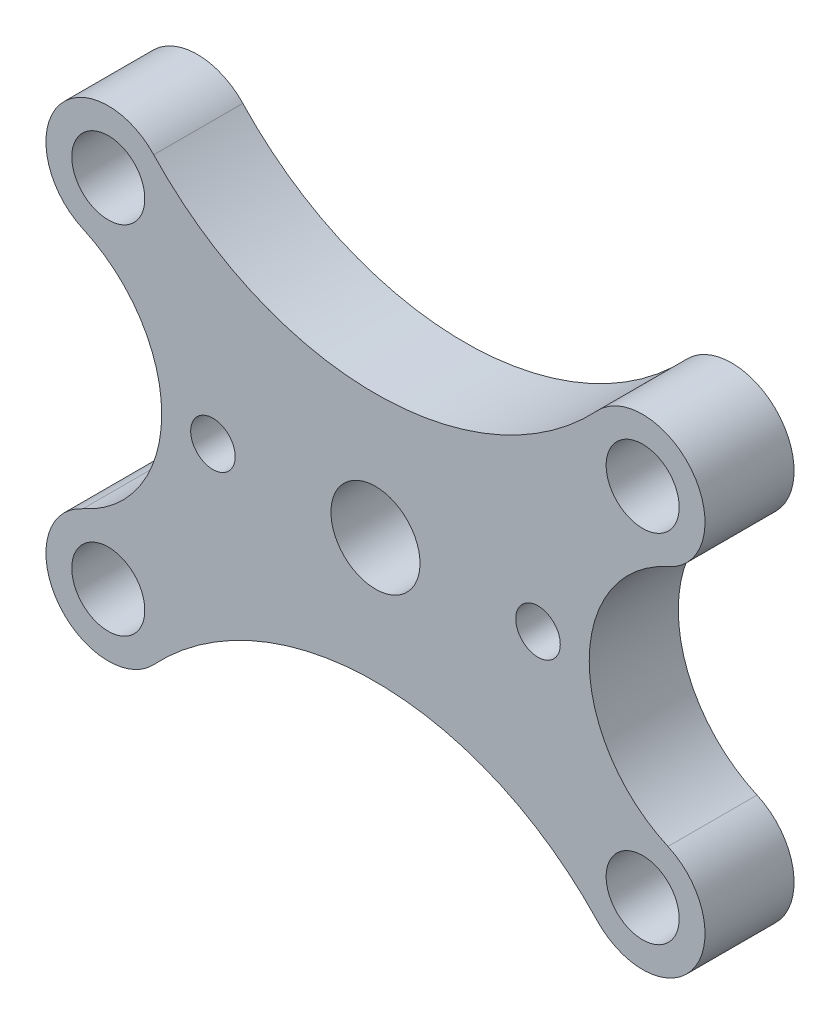
from build123d import *

# Parameters (mm, degrees)
SALIENTE_EXTRUIR1_DEPTH = 10
CROQUIS3_R              = 4.1
CORTAR_EXTRUIR1_DEPTH   = 47.882832679
CROQUIS9_R              = 2.5
CORTAR_EXTRUIR6_DEPTH   = 47.882832679
SIMETR_A2_OUTLINE_R     = 4.1
SIMETR_A2_OUTLINE_R_2   = 2.5
SIMETR_A2_DEPTH         = 10
CROQUIS8_R              = 5
CORTAR_EXTRUIR2_DEPTH   = 10


# Read off the part's stored shape, not the designer's step: Simetría2
with BuildPart() as part:
    # Croquis2 → Saliente-Extruir1 (new body)
    with BuildSketch(Plane.XY):
        with BuildLine():
            Line((24, 0), (0, 0))
            Line((0, 0), (0, 14))
            ThreePointArc((0, 14), (13.564530661, 16.812621552), (24.892422825, 24.786716558))
            ThreePointArc((24.892422825, 24.786716558), (35.705553054, 24.055448723), (32.841827768, 13.602811951))
            ThreePointArc((32.841827768, 13.602811951), (26.404704634, 8.111941988), (24, 0))
        make_face()
    saliente_extruir1 = extrude(amount=SALIENTE_EXTRUIR1_DEPTH)

    # Croquis3 → Cortar-Extruir1 (cut, through all)
    with BuildSketch(Plane.XY):
        with Locations((30, 20)):
            Circle(CROQUIS3_R)
    cortar_extruir1 = extrude(amount=CORTAR_EXTRUIR1_DEPTH, mode=Mode.SUBTRACT)

    # Simetría1: Saliente-Extruir1, Cortar-Extruir1 across plane
    add(saliente_extruir1.mirror(Plane.ZX))
    add(cortar_extruir1.mirror(Plane.ZX), mode=Mode.SUBTRACT)

    # Croquis9 → Cortar-Extruir6 (cut, through all)
    with BuildSketch(Plane.XY):
        with Locations((18.25, 0)):
            Circle(CROQUIS9_R)
    extrude(amount=CORTAR_EXTRUIR6_DEPTH, mode=Mode.SUBTRACT)

    # Simetría2 outline → Simetría2 (add)
    with BuildSketch(Plane.XY):
        with BuildLine():
            Line((0, -14), (0, 14))
            ThreePointArc((0, 14), (-13.564530661, 16.812621552), (-24.892422825, 24.786716558))
            ThreePointArc((-24.892422825, 24.786716558), (-35.705553054, 24.055448723), (-32.841827768, 13.602811951))
            ThreePointArc((-32.841827768, 13.602811951), (-24, 0), (-32.841827768, -13.602811951))
            ThreePointArc((-32.841827768, -13.602811951), (-35.705553054, -24.055448723), (-24.892422825, -24.786716558))
            ThreePointArc((-24.892422825, -24.786716558), (-13.564530661, -16.812621552), (0, -14))
        make_face()
        with Locations((-30, -20)):
            Circle(SIMETR_A2_OUTLINE_R, mode=Mode.SUBTRACT)
        with Locations((-30, 20)):
            Circle(SIMETR_A2_OUTLINE_R, mode=Mode.SUBTRACT)
        with Locations((-18.25, 0)):
            Circle(SIMETR_A2_OUTLINE_R_2, mode=Mode.SUBTRACT)
    extrude(amount=SIMETR_A2_DEPTH)

    # Croquis8 → Cortar-Extruir2 (cut)
    with BuildSketch(Plane.XY):
        Circle(CROQUIS8_R)
    extrude(amount=CORTAR_EXTRUIR2_DEPTH, mode=Mode.SUBTRACT)


solid = part.part
